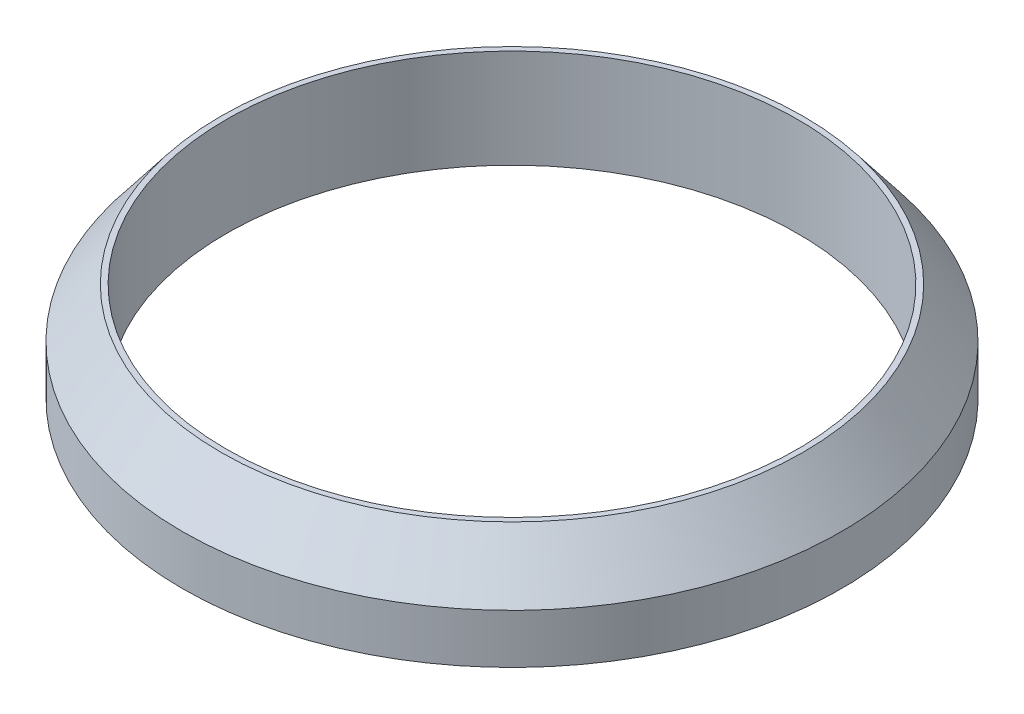
from build123d import *

# Parameters (mm, degrees)
SKETCH2_R           = 76.2
SKETCH2_R_2         = 66.04
BOSS_EXTRUDE1_DEPTH = 22.86


with BuildPart() as part:
    # Sketch2 → Boss-Extrude1 (new body)
    with BuildSketch(Plane(origin=(0, 0, 0), x_dir=(1, 0, 0), z_dir=(0, 1, 0))):
        Circle(SKETCH2_R)
        Circle(SKETCH2_R_2, mode=Mode.SUBTRACT)
    extrude(amount=BOSS_EXTRUDE1_DEPTH)

    # Sketch5 → Cut-Revolve2 (revolve, cut)
    with BuildSketch(Plane(origin=(0, 0, 0), x_dir=(0, 0, -1), z_dir=(1, 0, 0))):
        Polygon((-76.2, 11.43), (-67.31, 22.86), (-76.2, 22.86), align=None)
    revolve(axis=Axis((0, 0, 0), (0, 1, 0)), mode=Mode.SUBTRACT)


solid = part.part
